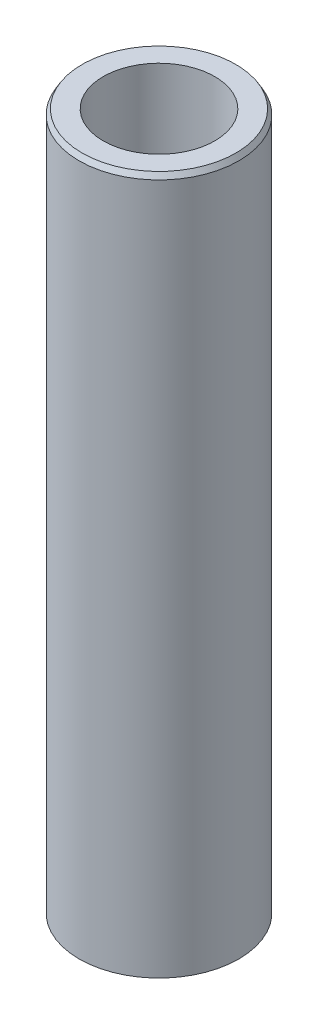
from build123d import *
from OCP.BRepFilletAPI import BRepFilletAPI_MakeChamfer

# Parameters (mm, degrees)
SKETCH1_R           = 57.5
BOSS_EXTRUDE1_DEPTH = 503.649247923
SKETCH2_R           = 40.15941242
CUT_EXTRUDE1_DEPTH  = 511.171603418
CHAMFER1_SIZE       = 3.764010191
CHAMFER1_SIZE2      = 2.173152297


with BuildPart() as part:
    # Sketch1 → Boss-Extrude1 (new body)
    with BuildSketch(Plane(origin=(0, 0, 0), x_dir=(1, 0, 0), z_dir=(0, 1, 0))):
        Circle(SKETCH1_R)
    extrude(amount=BOSS_EXTRUDE1_DEPTH)

    # Sketch2 → Cut-Extrude1 (cut, through all)
    with BuildSketch(Plane(origin=(0, 0, 0), x_dir=(1, 0, 0), z_dir=(0, 1, 0))):
        Circle(SKETCH2_R)
    extrude(amount=CUT_EXTRUDE1_DEPTH, mode=Mode.SUBTRACT)

    # Chamfer1: one chamfer whose edges measure the first distance from different faces: ONE call of the kernel's chamfer builder (chamfer() names one face for all edges)
    chamfer1_edges_1 = [part.edges().sort_by_distance(p)[0] for p in [
        (-57.5, 503.649247923, 0),
    ]]
    chamfer1_side_1 = [part.faces().sort_by_distance(p)[0] for p in [
        (-57.5, 251.824623962, 0),
    ]]
    chamfer1_edges_2 = [part.edges().sort_by_distance(p)[0] for p in [
        (-57.5, 0, 0),
    ]]
    chamfer1_side_2 = [part.faces().sort_by_distance(p)[0] for p in [
        (-55.873654403, 0, 0),
    ]]
    chamfer1 = BRepFilletAPI_MakeChamfer(part.part.solid().wrapped)
    for e in chamfer1_edges_1:
        chamfer1.Add(CHAMFER1_SIZE, CHAMFER1_SIZE2, e.wrapped, chamfer1_side_1[0].wrapped)  # the first distance lies on this face
    for e in chamfer1_edges_2:
        chamfer1.Add(CHAMFER1_SIZE, CHAMFER1_SIZE2, e.wrapped, chamfer1_side_2[0].wrapped)  # the first distance lies on this face
    add(Compound.cast(chamfer1.Shape()), mode=Mode.REPLACE)


solid = part.part
